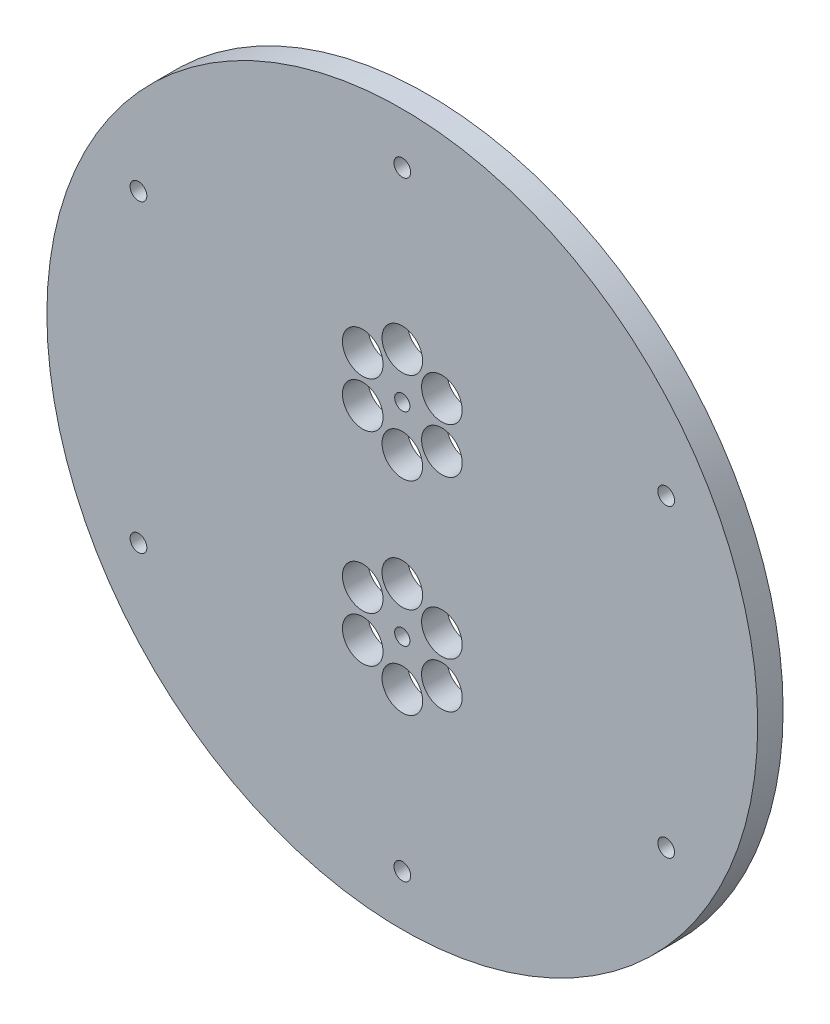
from build123d import *

# Parameters (mm, degrees)
SKETCH1_R           = 70
SKETCH1_R_2         = 1.65
SKETCH1_R_3         = 4
SKETCH1_R_4         = 1.5
BOSS_EXTRUDE1_DEPTH = 5


with BuildPart() as part:
    # Sketch1 → Boss-Extrude1 (new body)
    with BuildSketch(Plane.XY):
        Circle(SKETCH1_R)
        with Locations((0, 60)):
            Circle(SKETCH1_R_2, mode=Mode.SUBTRACT)
        with Locations((51.961524227, 30)):
            Circle(SKETCH1_R_2, mode=Mode.SUBTRACT)
        with Locations((51.961524227, -30)):
            Circle(SKETCH1_R_2, mode=Mode.SUBTRACT)
        with Locations((0, -60)):
            Circle(SKETCH1_R_2, mode=Mode.SUBTRACT)
        with Locations((-51.961524227, -30)):
            Circle(SKETCH1_R_2, mode=Mode.SUBTRACT)
        with Locations((-51.961524227, 30)):
            Circle(SKETCH1_R_2, mode=Mode.SUBTRACT)
        with Locations((0, 29)):
            Circle(SKETCH1_R_3, mode=Mode.SUBTRACT)
        with Locations((7.794228634, 24.5)):
            Circle(SKETCH1_R_3, mode=Mode.SUBTRACT)
        with Locations((7.794228634, 15.5)):
            Circle(SKETCH1_R_3, mode=Mode.SUBTRACT)
        with Locations((0, 11)):
            Circle(SKETCH1_R_3, mode=Mode.SUBTRACT)
        with Locations((-7.794228634, 15.5)):
            Circle(SKETCH1_R_3, mode=Mode.SUBTRACT)
        with Locations((-7.794228634, 24.5)):
            Circle(SKETCH1_R_3, mode=Mode.SUBTRACT)
        with Locations((0, 20)):
            Circle(SKETCH1_R_4, mode=Mode.SUBTRACT)
        with Locations((7.794228634, -15.5)):
            Circle(SKETCH1_R_3, mode=Mode.SUBTRACT)
        with Locations((0, -11)):
            Circle(SKETCH1_R_3, mode=Mode.SUBTRACT)
        with Locations((-7.794228634, -15.5)):
            Circle(SKETCH1_R_3, mode=Mode.SUBTRACT)
        with Locations((0, -20)):
            Circle(SKETCH1_R_4, mode=Mode.SUBTRACT)
        with Locations((-7.794228634, -24.5)):
            Circle(SKETCH1_R_3, mode=Mode.SUBTRACT)
        with Locations((0, -29)):
            Circle(SKETCH1_R_3, mode=Mode.SUBTRACT)
        with Locations((7.794228634, -24.5)):
            Circle(SKETCH1_R_3, mode=Mode.SUBTRACT)
    extrude(amount=BOSS_EXTRUDE1_DEPTH)


solid = part.part
